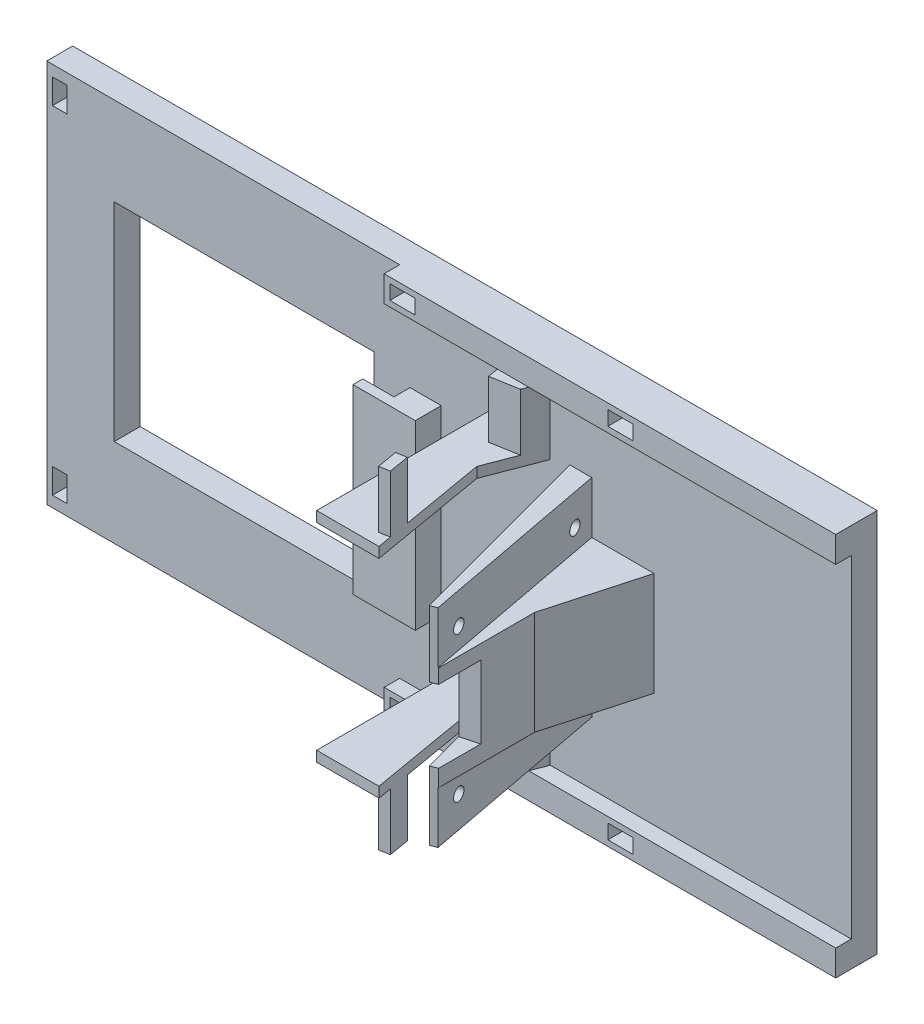
from build123d import *

# Parameters (mm, degrees)
CROQUIS1_W               = 118
CROQUIS1_H               = 74
SALIENTE_EXTRUIR1_DEPTH  = 5
CROQUIS2_W               = 50
CROQUIS2_H               = 40
CORTAR_EXTRUIR1_DEPTH    = 5
CROQUIS3_W               = 50
CROQUIS3_H               = 5
SALIENTE_EXTRUIR2_DEPTH  = 3
CROQUIS4_W               = 4.8
CROQUIS4_H               = 2.8
CROQUIS4_W_2             = 2.8
CROQUIS4_H_2             = 4.8
CORTAR_EXTRUIR2_DEPTH    = 6
CROQUIS5_W               = 3
CROQUIS5_H               = 40
CORTAR_EXTRUIR3_DEPTH    = 3
CROQUIS6_W               = 12
CROQUIS6_H               = 40
SALIENTE_EXTRUIR3_DEPTH  = 40
CROQUIS8_W               = 4
CROQUIS8_H               = 35
SALIENTE_EXTRUIR5_DEPTH  = 5
SALIENTE_EXTRUIR7_DEPTH  = 33
CORTAR_EXTRUIR6_DEPTH    = 11
CORTAR_EXTRUIR7_DEPTH    = 13
CORTAR_EXTRUIR8_DEPTH    = 13
CORTAR_EXTRUIR9_DEPTH    = 11
CROQUIS10_W              = 1.9
CROQUIS10_H              = 35
SALIENTE_EXTRUIR9_DEPTH  = 8
CROQUIS22_W              = 3.1
CROQUIS22_H              = 35
SALIENTE_EXTRUIR10_DEPTH = 2
CORTAR_EXTRUIR11_DEPTH   = 40
CROQUIS23_W              = 3
CROQUIS23_H              = 40
SALIENTE_EXTRUIR11_DEPTH = 10
CORTAR_EXTRUIR12_DEPTH   = 10
CORTAR_EXTRUIR13_DEPTH   = 10
CORTAR_EXTRUIR14_DEPTH   = 40
CROQUIS28_R              = 1.25
CORTAR_EXTRUIR15_DEPTH   = 5
SALIENTE_EXTRUIR12_DEPTH = 37
CROQUIS30_W              = 29.42787794
CROQUIS30_H              = 11
SALIENTE_EXTRUIR13_DEPTH = 1.970920231
CHAFL_N1_SIZE            = 5
CHAFL_N1_SIZE2           = 18
CHAFL_N2_SIZE            = 5
CHAFL_N2_SIZE_2          = 13
CHAFL_N3_SIZE            = 5
CHAFL_N3_SIZE_2          = 13
CROQUIS51_W              = 8
CROQUIS51_H              = 14
CORTAR_EXTRUIR23_DEPTH   = 10
CROQUIS52_W              = 9
CROQUIS52_H              = 11
CROQUIS52_W_2            = 8
CROQUIS52_W_3            = 4.539822883
CORTAR_EXTRUIR25_DEPTH   = 10
SALIENTE_EXTRUIR20_DEPTH = 12
CROQUIS54_W              = 5
CROQUIS54_H              = 11
CORTAR_EXTRUIR26_DEPTH   = 10
CROQUIS55_W              = 5
CROQUIS55_H              = 11
CORTAR_EXTRUIR30_DEPTH   = 10


with BuildPart() as part:
    # Croquis1 → Saliente-Extruir1 (new body)
    with BuildSketch(Plane.XY):
        Rectangle(CROQUIS1_W, CROQUIS1_H)
    extrude(amount=SALIENTE_EXTRUIR1_DEPTH)

    # Croquis2 → Cortar-Extruir1 (cut)
    with BuildSketch(Plane.XY.offset(5)):
        with Locations((-21, 0)):
            Rectangle(CROQUIS2_W, CROQUIS2_H)
    extrude(amount=-CORTAR_EXTRUIR1_DEPTH, mode=Mode.SUBTRACT)

    # Croquis3 → Saliente-Extruir2 (add)
    with BuildSketch(Plane.XY.offset(5)):
        with Locations((34, 34.5)):
            Rectangle(CROQUIS3_W, CROQUIS3_H)
        with Locations((34, -34.5)):
            Rectangle(CROQUIS3_W, CROQUIS3_H)
    extrude(amount=SALIENTE_EXTRUIR2_DEPTH)

    # Croquis4 → Cortar-Extruir2 (cut)
    with BuildSketch(Plane.XY.offset(8)):
        with Locations((54.5, 34.5)):
            Rectangle(CROQUIS4_W, CROQUIS4_H)
        with Locations((12.5, 34.5)):
            Rectangle(CROQUIS4_W, CROQUIS4_H)
        with Locations((12.5, -34.5)):
            Rectangle(CROQUIS4_W, CROQUIS4_H)
        with Locations((54.5, -34.5)):
            Rectangle(CROQUIS4_W, CROQUIS4_H)
        with Locations((-56.5, -32.5)):
            Rectangle(CROQUIS4_W_2, CROQUIS4_H_2)
        with Locations((-56.5, 32.5)):
            Rectangle(CROQUIS4_W_2, CROQUIS4_H_2)
    extrude(amount=-CORTAR_EXTRUIR2_DEPTH, mode=Mode.SUBTRACT)

    # Croquis5 → Cortar-Extruir3 (cut)
    with BuildSketch(Plane.XY.offset(5)):
        with Locations((39.5, 0)):
            Rectangle(CROQUIS5_W, CROQUIS5_H)
    extrude(amount=-CORTAR_EXTRUIR3_DEPTH, mode=Mode.SUBTRACT)

    # Croquis6 → Saliente-Extruir3 (add)
    with BuildSketch(Plane.XY.offset(2)):
        with Locations((47, 0)):
            Rectangle(CROQUIS6_W, CROQUIS6_H)
    extrude(amount=SALIENTE_EXTRUIR3_DEPTH)

    # Croquis8 → Saliente-Extruir5 (add)
    with BuildSketch(Plane.XY.offset(5)):
        with Locations((15, 0)):
            Rectangle(CROQUIS8_W, CROQUIS8_H)
    extrude(amount=SALIENTE_EXTRUIR5_DEPTH)

    # Croquis12 → Saliente-Extruir7 (add)
    with BuildSketch(Plane.XY.offset(5)):
        Polygon((26, -19), (38, -19), (38, -32), (31, -32), (31, -21), (26, -21), align=None)
        Polygon((31, 32), (38, 32), (38, 19), (26, 19), (26, 21), (31, 21), align=None)
    extrude(amount=SALIENTE_EXTRUIR7_DEPTH)

    # Croquis14 → Cortar-Extruir6 (cut)
    with BuildSketch(Plane(origin=(0, 32, 0), x_dir=(1, 0, 0), z_dir=(0, 1, 0))):
        Polygon((31, -38), (36, -38), (31, -9), align=None)
    extrude(amount=-CORTAR_EXTRUIR6_DEPTH, mode=Mode.SUBTRACT)

    # Croquis16 → Cortar-Extruir7 (cut)
    with BuildSketch(Plane.XZ.offset(-19)):
        Polygon((38, 38), (38, 5), (33, 5), (33, 9), align=None)
    extrude(amount=-CORTAR_EXTRUIR7_DEPTH, mode=Mode.SUBTRACT)

    # Croquis17 → Cortar-Extruir8 (cut)
    with BuildSketch(Plane.XZ.offset(32)):
        Polygon((38, 38), (38, 5), (33, 5), (33, 9), align=None)
    extrude(amount=-CORTAR_EXTRUIR8_DEPTH, mode=Mode.SUBTRACT)

    # Croquis18 → Cortar-Extruir9 (cut)
    with BuildSketch(Plane.XZ.offset(32)):
        Polygon((31, 38), (36, 38), (31, 9), align=None)
    extrude(amount=-CORTAR_EXTRUIR9_DEPTH, mode=Mode.SUBTRACT)

    # Croquis10 → Saliente-Extruir9 (add)
    with BuildSketch(Plane.ZY.offset(-13)):
        with Locations((9.05, 0)):
            Rectangle(CROQUIS10_W, CROQUIS10_H)
    extrude(amount=SALIENTE_EXTRUIR9_DEPTH)

    # Croquis22 → Saliente-Extruir10 (add)
    with BuildSketch(Plane.ZY.offset(-13)):
        with Locations((6.55, 0)):
            Rectangle(CROQUIS22_W, CROQUIS22_H)
    extrude(amount=SALIENTE_EXTRUIR10_DEPTH)

    # Croquis7 → Cortar-Extruir11 (cut)
    with BuildSketch(Plane.XZ.offset(20)):
        Polygon((51.717967697, 42), (41, 2), (41, 42), align=None)
    extrude(amount=-CORTAR_EXTRUIR11_DEPTH, mode=Mode.SUBTRACT)

    # Croquis23 → Saliente-Extruir11 (add)
    with BuildSketch(Plane(origin=(38, 0, 0), x_dir=(0, 0, -1), z_dir=(1, 0, 0))):
        with Locations((-3.5, 0)):
            Rectangle(CROQUIS23_W, CROQUIS23_H)
    extrude(amount=SALIENTE_EXTRUIR11_DEPTH)

    # Croquis25 → Cortar-Extruir12 (cut)
    with BuildSketch(Plane.XZ.offset(20)):
        Polygon((53, 42), (53, 5), (46, 5), align=None)
    extrude(amount=-CORTAR_EXTRUIR12_DEPTH, mode=Mode.SUBTRACT)

    # Croquis26 → Cortar-Extruir13 (cut)
    with BuildSketch(Plane(origin=(0, 20, 0), x_dir=(1, 0, 0), z_dir=(0, 1, 0))):
        Polygon((53, -5), (53, -42), (46, -5), align=None)
    extrude(amount=-CORTAR_EXTRUIR13_DEPTH, mode=Mode.SUBTRACT)

    # Croquis27 → Cortar-Extruir14 (cut)
    with BuildSketch(Plane.XZ.offset(20)):
        Polygon((51.717967697, 42), (53, 42), (53, 41.49489384), align=None)
    extrude(amount=-CORTAR_EXTRUIR14_DEPTH, mode=Mode.SUBTRACT)

    # Croquis28 → Cortar-Extruir15 (cut)
    with BuildSketch(Plane(origin=(37.753520778, 0, -10.116025404), x_dir=(0.25881904510251397, 0, 0.9659258262890701), z_dir=(-0.9659258262890701, 0, 0.25881904510251397))):
        with Locations((20.801870381, 14)):
            Circle(CROQUIS28_R)
        with Locations((48.801870381, 14)):
            Circle(CROQUIS28_R)
        with Locations((48.801870381, -14)):
            Circle(CROQUIS28_R)
        with Locations((20.801870381, -14)):
            Circle(CROQUIS28_R)
    extrude(amount=-CORTAR_EXTRUIR15_DEPTH, mode=Mode.SUBTRACT)

    # Croquis29 → Saliente-Extruir12 (add)
    with BuildSketch(Plane(origin=(59, 0, 0), x_dir=(0, 0, -1), z_dir=(1, 0, 0))):
        Polygon((-8, 37), (0, 37), (0, -37), (-8, -37), (-8, -32), (-5, -32), (-5, 32), (-8, 32), align=None)
    extrude(amount=SALIENTE_EXTRUIR12_DEPTH)

    # Croquis30 → Saliente-Extruir13 (add)
    with BuildSketch(Plane(origin=(28.598152425, 0, -4.930715935), x_dir=(0.1699069165076461, 0, 0.9854601157443481), z_dir=(-0.9854601157443481, 0, 0.1699069165076461))):
        with Locations((28.850194423, 26.5)):
            Rectangle(CROQUIS30_W, CROQUIS30_H)
    saliente_extruir13 = extrude(amount=-SALIENTE_EXTRUIR13_DEPTH)

    # Simetría3: Saliente-Extruir13 across plane
    add(saliente_extruir13.mirror(Plane.ZX))

    # Chaflán1
    chafl_n1_edges = [part.edges().sort_by_distance(p)[0] for p in [
        (53, 0, 5),
    ]]
    chafl_n1_side = [part.faces().sort_by_distance(p)[0] for p in [
        (23.870652036, 0, 5),
    ]]
    chamfer(chafl_n1_edges, length=CHAFL_N1_SIZE, length2=CHAFL_N1_SIZE2, reference=chafl_n1_side[0])

    # Chaflán2
    # the kernel refuses this chamfer: 13, 5 mm, written as the material it adds along each edge
    with BuildSketch(Plane(origin=(33, 19, 5), x_dir=(0.9956504543602249, 0, -0.09316744459454417), z_dir=(0, 1, 0))) as chafl_n2_piece_1:
        Polygon((CHAFL_N2_SIZE * 0.99565045436, -CHAFL_N2_SIZE * 0.0931674445945), (-CHAFL_N2_SIZE_2 * 0.0931674445945, -CHAFL_N2_SIZE_2 * 0.99565045436), (0, 0), align=None)
    extrude(amount=13)

    # Chaflán3
    # the kernel refuses this chamfer: 13, 5 mm, written as the material it adds along each edge
    with BuildSketch(Plane(origin=(33, -32, 5), x_dir=(0.9956504543602249, 0, -0.09316744459454485), z_dir=(0, 1, 0))) as chafl_n3_piece_1:
        Polygon((CHAFL_N3_SIZE * 0.99565045436, -CHAFL_N3_SIZE * 0.0931674445945), (-CHAFL_N3_SIZE_2 * 0.0931674445945, -CHAFL_N3_SIZE_2 * 0.99565045436), (0, 0), align=None)
    extrude(amount=13)

    # Croquis51 → Cortar-Extruir23 (cut)
    with BuildSketch(Plane(origin=(37.753520778, 0, -10.116025404), x_dir=(0.2588190451025144, 0, 0.96592582628907), z_dir=(-0.96592582628907, 0, 0.2588190451025144))):
        with Locations((49.954479718, 0.233117344)):
            Rectangle(CROQUIS51_W, CROQUIS51_H)
    extrude(amount=-CORTAR_EXTRUIR23_DEPTH, mode=Mode.SUBTRACT)

    # Croquis52 → Cortar-Extruir25 (cut)
    with BuildSketch(Plane(origin=(28.598152425, 0, -4.930715935), x_dir=(0.1699069165076461, 0, 0.985460115744348), z_dir=(-0.985460115744348, 0, 0.1699069165076461))):
        with Locations((19.69441499, -26.5)):
            Rectangle(CROQUIS52_W, CROQUIS52_H)
        with Locations((33.19441499, -26.5)):
            Rectangle(CROQUIS52_W_2, CROQUIS52_H)
        with Locations((43.464326432, -26.5)):
            Rectangle(CROQUIS52_W_3, CROQUIS52_H)
    cortar_extruir25 = extrude(amount=-CORTAR_EXTRUIR25_DEPTH, mode=Mode.SUBTRACT)

    # Croquis53 → Saliente-Extruir20 (add)
    with BuildSketch(Plane.XZ.offset(32)):
        Polygon((31, 9), (30.122515807, 3.910591681), (31.179788624, 3.910591681), align=None)
    saliente_extruir20 = extrude(amount=-SALIENTE_EXTRUIR20_DEPTH)

    # Simetría8: Cortar-Extruir25, Saliente-Extruir20 across plane
    add(cortar_extruir25.mirror(Plane.ZX), mode=Mode.SUBTRACT)
    add(saliente_extruir20.mirror(Plane.ZX))

    # Croquis54 → Cortar-Extruir26 (cut)
    with BuildSketch(Plane(origin=(28.598152425, 0, -4.930715935), x_dir=(0.16990691650764617, 0, 0.985460115744348), z_dir=(-0.985460115744348, 0, 0.16990691650764617))):
        with Locations((26.69441499, 26.5)):
            Rectangle(CROQUIS54_W, CROQUIS54_H)
    extrude(amount=-CORTAR_EXTRUIR26_DEPTH, mode=Mode.SUBTRACT)

    # Croquis55 → Cortar-Extruir30 (cut)
    with BuildSketch(Plane(origin=(28.598152425, 0, -4.930715935), x_dir=(0.16990691650764617, 0, 0.985460115744348), z_dir=(-0.985460115744348, 0, 0.16990691650764617))):
        with Locations((26.69441499, -26.5)):
            Rectangle(CROQUIS55_W, CROQUIS55_H)
    extrude(amount=-CORTAR_EXTRUIR30_DEPTH, mode=Mode.SUBTRACT)


solid = part.part
